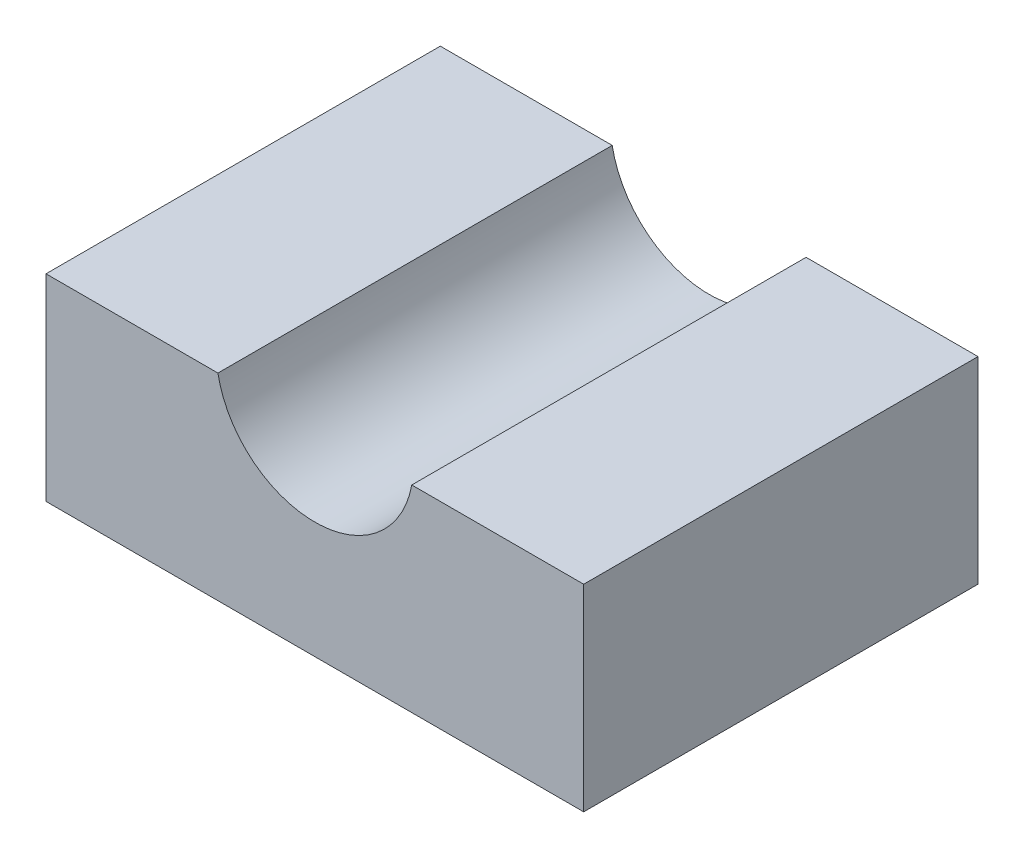
from build123d import *

# Parameters (mm, degrees)
BOSS_EXTRUDE1_DEPTH = 22


with BuildPart() as part:
    # Sketch1 → Boss-Extrude1 (new body)
    with BuildSketch(Plane.XY):
        with BuildLine():
            Line((-5.408326913, -1), (-15, -1))
            Line((-15, -1), (-15, -12))
            Line((-15, -12), (15, -12))
            Line((15, -12), (15, -1))
            Line((15, -1), (5.408326913, -1))
            ThreePointArc((5.408326913, -1), (0, -5.5), (-5.408326913, -1))
        make_face()
    extrude(amount=BOSS_EXTRUDE1_DEPTH)


solid = part.part
